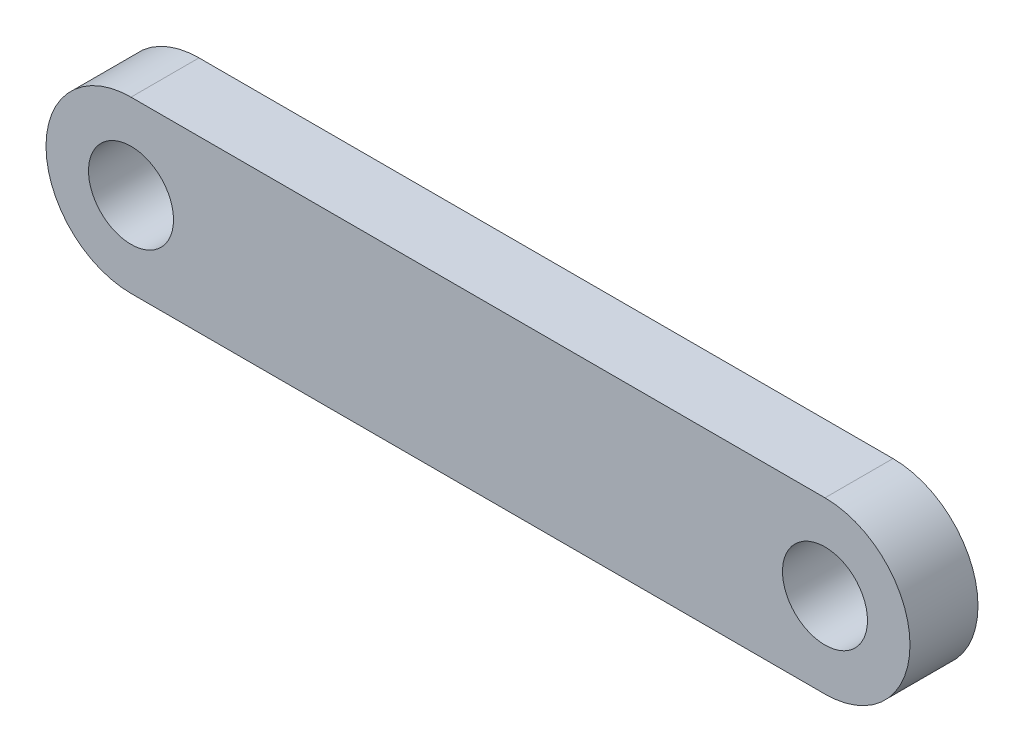
from build123d import *

# Parameters (mm, degrees)
SKETCH1_R           = 1.5875
BOSS_EXTRUDE2_DEPTH = 2.54


with BuildPart() as part:
    # Sketch1 → Boss-Extrude2 (new body)
    with BuildSketch(Plane.XY):
        with BuildLine():
            Line((25.9207, 3.175), (0, 3.175))
            ThreePointArc((0, 3.175), (-3.175, 0), (0, -3.175))
            Line((0, -3.175), (25.9207, -3.175))
            ThreePointArc((25.9207, -3.175), (29.0957, 0), (25.9207, 3.175))
        make_face()
        with Locations((25.9207, 0)):
            Circle(SKETCH1_R, mode=Mode.SUBTRACT)
        Circle(SKETCH1_R, mode=Mode.SUBTRACT)
    extrude(amount=BOSS_EXTRUDE2_DEPTH)


solid = part.part
